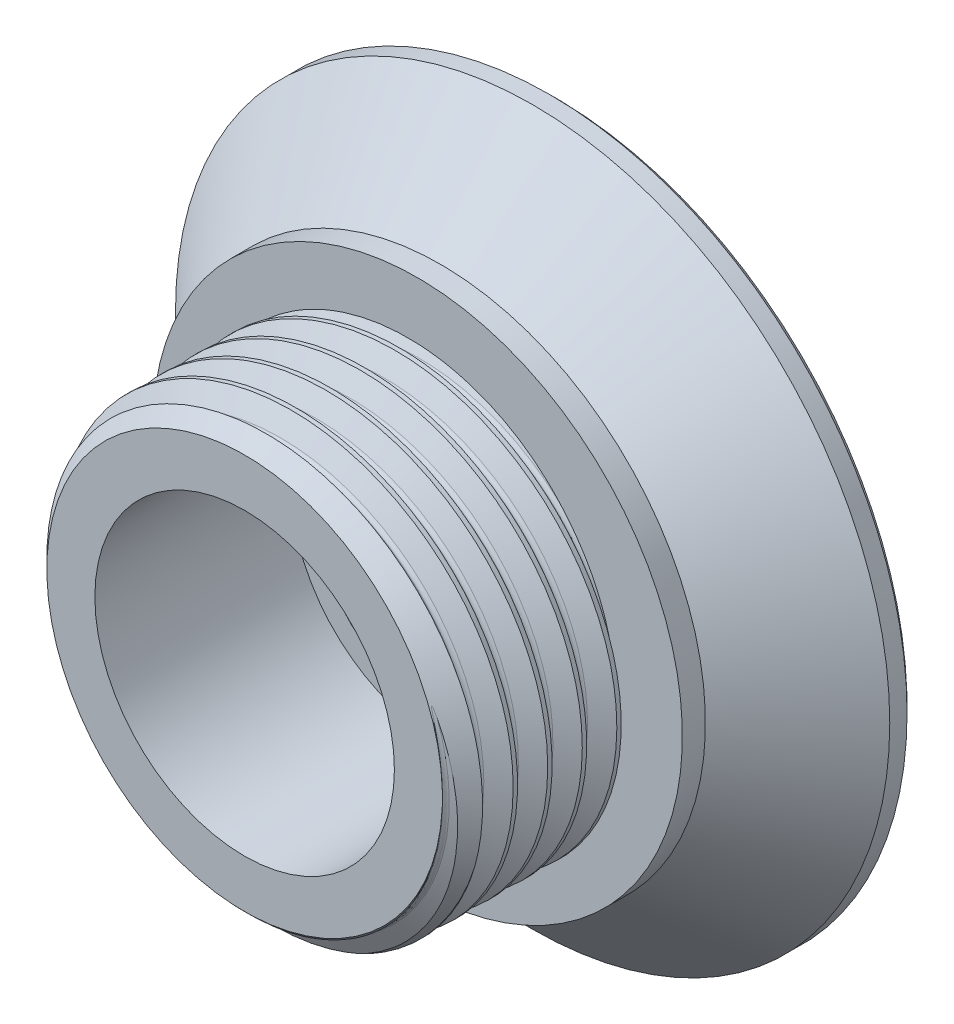
from build123d import *

# Parameters (mm, degrees)
SWEEP1_PITCH            = 3
CUT_EXTRUDE1_DEPTH      = 54.122499997
CUT_EXTRUDE1_DEPTH_BACK = 54.122499997
CHAMFER1_SIZE           = 0.5


with BuildPart() as part:
    # Sketch1 → Revolve1 (revolve)
    with BuildSketch(Plane(origin=(0, 0, 0), x_dir=(0, 0, -1), z_dir=(1, 0, 0)), mode=Mode.PRIVATE) as revolve1_sk:
        Polygon((-10, 11.1), (-3, 11.1), (-3, 8.5), (0, 8.5), (0, 31), (-2, 31), (-10, 23), (-12, 23), (-12, 17.17), (-27, 17.17), (-27, 13), (-10, 13), align=None)
    revolve(revolve1_sk.sketch.rotate(Axis((0, 0, 0), (0, 0, 1)), 90), axis=Axis((0, 0, 0), (0, 0, 1)))

    # Sweep1: arcs per turn and ends read off the stored shape
    # Sweep1: the profile of Sketch3 screwed along a right-hand helix through 6 turns, 10 arcs to a turn; built about Z, then put on its axis
    sweep1_z = Axis((0, 0, 0), (0, 0, 1))
    sweep1_corners = [(17.169797426, 6.2931e-05, -2e-09), (17.169797426, 6.2931e-05, -2.990000002), (17.384797426, 6.3719e-05, -2.617609079), (18.999797426, 6.9638e-05, -1.685188394), (18.999797426, 6.9638e-05, -1.304811611), (17.384797426, 6.3719e-05, -0.372390926)]
    with BuildLine(mode=Mode.PRIVATE) as sweep1_profile:
        Line(sweep1_corners[0], sweep1_corners[1])
        Line(sweep1_corners[2], sweep1_corners[3])
        Line(sweep1_corners[3], sweep1_corners[4])
        Line(sweep1_corners[4], sweep1_corners[5])
        ThreePointArc((17.169797426, 6.2931e-05, -2.990000002), (17.227406502, 6.3142e-05, -2.775000002), (17.384797426, 6.3719e-05, -2.617609079))
        ThreePointArc((17.384797426, 6.3719e-05, -0.372390926), (17.227406502, 6.3142e-05, -0.215000002), (17.169797426, 6.2931e-05, -2e-09))
    sweep1_cap = Face(sweep1_profile.wire())
    sweep1_arcs = [((17.169797426, 6.2931e-05, -2.990000002), (17.169797426, 6.2931e-05, -2.741739386), (17.384797426, 6.3719e-05, -2.617609079), (1, 0.8660254037844515, 1)), ((17.384797426, 6.3719e-05, -0.372390926), (17.169797426, 6.2931e-05, -0.248260618), (17.169797426, 6.2931e-05, -2e-09), (1, 0.8660254037844315, 1))]  # start, shoulder, end, weights
    sweep1_turn_angles = [0, 18, 36, 54, 72, 90, 108, 126, 144, 162, 180, 198, 216, 234, 252, 270, 288, 306, 324, 342, 360]
    sweep1_turn_weights = [1, 0.9510565162951535, 1, 0.9510565162951535, 1, 0.9510565162951535, 1, 0.9510565162951535, 1, 0.9510565162951535, 1, 0.9510565162951535, 1, 0.9510565162951535, 1, 0.9510565162951535, 1, 0.9510565162951535, 1, 0.9510565162951535, 1]
    sweep1_turn_rails = [Edge.make_bspline([Vector(p[0], p[1], 0).rotate(sweep1_z, sweep1_turn_angles[k]) / sweep1_turn_weights[k] + Vector(0, 0, p[2] + SWEEP1_PITCH * sweep1_turn_angles[k] / 360) for k in range(21)], [0, 0, 0, 1, 1, 2, 2, 3, 3, 4, 4, 5, 5, 6, 6, 7, 7, 8, 8, 9, 9, 10, 10, 10], 2, sweep1_turn_weights) for p in sweep1_corners]
    sweep1_turn_sides = [*[Face.make_surface_from_curves(sweep1_turn_rails[p[0]], sweep1_turn_rails[p[1]]) for p in [(0, 1), (2, 3), (3, 4), (4, 5)]], *[Face.make_bezier_surface([[Vector(p[j][0], p[j][1], 0).rotate(sweep1_z, sweep1_turn_angles[2 * i + k]) / sweep1_turn_weights[2 * i + k] + Vector(0, 0, p[j][2] + SWEEP1_PITCH * sweep1_turn_angles[2 * i + k] / 360) for k in range(3)] for j in range(3)], [[p[3][j] * sweep1_turn_weights[2 * i + k] for k in range(3)] for j in range(3)]) for p in sweep1_arcs for i in range(10)]]
    sweep1 = Plane(origin=(0, 0, 12), x_dir=(1, 0, 0), z_dir=(0, 0, 1)) * Solid(Shell([*[p.moved(Location((0, 0, SWEEP1_PITCH * i))) for i in range(6) for p in sweep1_turn_sides], sweep1_cap, sweep1_cap.rotate(sweep1_z, 2160).moved(Location((0, 0, SWEEP1_PITCH * 2160 / 360)))]))
    add(sweep1)

    # Sketch4 → Cut-Extrude1 (cut, two sides: drawn at the far end of the back side and taken through both)
    with BuildSketch(Plane(origin=(0, 0, 0), x_dir=(1, 0, 0), z_dir=(0, 1, 0)).offset(-CUT_EXTRUDE1_DEPTH_BACK)):
        Polygon((-174.665220613, -27), (-23.975009479, -27), (33.95716956, -27), (184.647380693, -27), (184.647380693, -328.380422267), (-174.665220613, -328.380422267), align=None)
    extrude(amount=CUT_EXTRUDE1_DEPTH + CUT_EXTRUDE1_DEPTH_BACK, mode=Mode.SUBTRACT)

    # Sketch5 → Cut-Revolve1 (revolve, cut)
    with BuildSketch(Plane(origin=(0, 0, 0), x_dir=(1, 0, 0), z_dir=(0, 1, 0))):
        Polygon((17.17, -27), (19.67, -27), (19.67, -24.5), align=None)
    revolve(axis=Axis((0, 0, 0), (0, 0, 1)), mode=Mode.SUBTRACT)

    # Chamfer1
    chamfer1_edges = [part.edges().sort_by_distance(p)[0] for p in [
        (8.5, 0, 0),
        (8.5, 0, 3),
        (31, 0, 0),
    ]]
    chamfer(chamfer1_edges, length=CHAMFER1_SIZE)


solid = part.part
